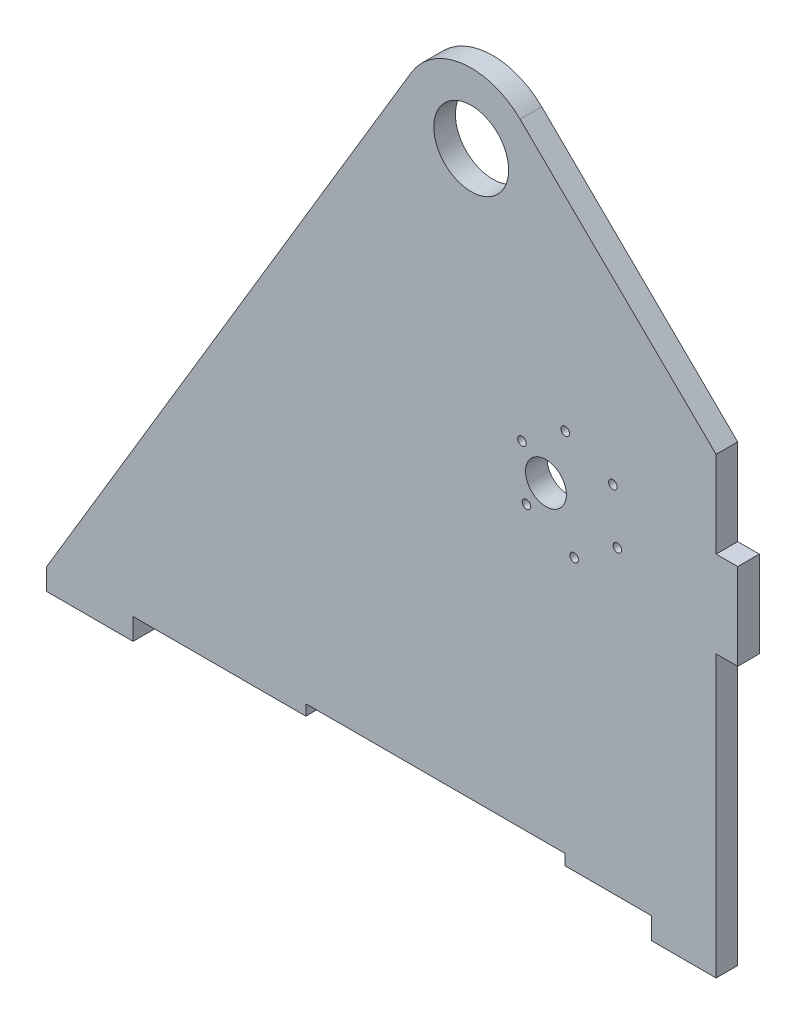
from build123d import *

# Parameters (mm, degrees)
SKETCH2_R               = 11
BOSS_EXTRUDE1_DEPTH     = 6.35
CUT_EXTRUDE2_DEPTH      = 1781.261525592
CUT_EXTRUDE2_DEPTH_BACK = 1781.261525592
SKETCH5_R               = 6
SKETCH5_R_2             = 1.25


with BuildPart() as part:
    # Sketch2 → Boss-Extrude1 (new body)
    with BuildSketch(Plane.XY):
        with BuildLine():
            Line((1592.072, 2.542062626), (1642.872, 2.542062626))
            Line((1642.872, 2.542062626), (1642.872, 5.717062626))
            Line((1642.872, 5.717062626), (1719.072, 5.717062626))
            Line((1719.072, 5.717062626), (1719.072, 2.542062626))
            Line((1719.072, 2.542062626), (1744.472, 2.542062626))
            Line((1744.472, 2.542062626), (1744.472, -3.807937374))
            Line((1744.472, -3.807937374), (1763.522, -3.807937374))
            Line((1763.522, -3.807937374), (1763.522, 78.742062626))
            Line((1763.522, 78.742062626), (1769.872, 78.742062626))
            Line((1769.872, 78.742062626), (1769.872, 104.142062626))
            Line((1769.872, 104.142062626), (1763.522, 104.142062626))
            Line((1763.522, 104.142062626), (1763.522, 129.542062626))
            Line((1763.522, 129.542062626), (1705.876596213, 186.076487834))
            ThreePointArc((1705.876596213, 186.076487834), (1688.880232851, 191.779061014), (1673.886428724, 181.951469947))
            Line((1673.886428724, 181.951469947), (1566.672, 2.542062626))
            Line((1566.672, 2.542062626), (1566.672, -3.807937374))
            Line((1566.672, -3.807937374), (1592.072, -3.807937374))
            Line((1592.072, -3.807937374), (1592.072, 2.542062626))
        make_face()
        with Locations((1691.505126, 171.422598626)):
            Circle(SKETCH2_R, mode=Mode.SUBTRACT)
    extrude(amount=BOSS_EXTRUDE1_DEPTH)

    # Sketch5 → Cut-Extrude2 (cut, two sides: drawn at the far end of the back side and taken through both)
    with BuildSketch(Plane(origin=(0, 0, 0), x_dir=(-1, 0, 0), z_dir=(0, 0, -1)).offset(-CUT_EXTRUDE2_DEPTH_BACK)):
        with Locations((-1713.483088848, 97.22402394)):
            Circle(SKETCH5_R)
        with Locations((-1734.491506887, 91.238718255)):
            Circle(SKETCH5_R_2)
        with Locations((-1721.775720738, 82.375379007)):
            Circle(SKETCH5_R_2)
        with Locations((-1707.741950713, 88.955903217)):
            Circle(SKETCH5_R_2)
        with Locations((-1733.17352301, 106.682581713)):
            Circle(SKETCH5_R_2)
        with Locations((-1719.139752985, 113.263105923)):
            Circle(SKETCH5_R_2)
        with Locations((-1706.423966836, 104.399766675)):
            Circle(SKETCH5_R_2)
    extrude(amount=CUT_EXTRUDE2_DEPTH + CUT_EXTRUDE2_DEPTH_BACK, mode=Mode.SUBTRACT)


solid = part.part
